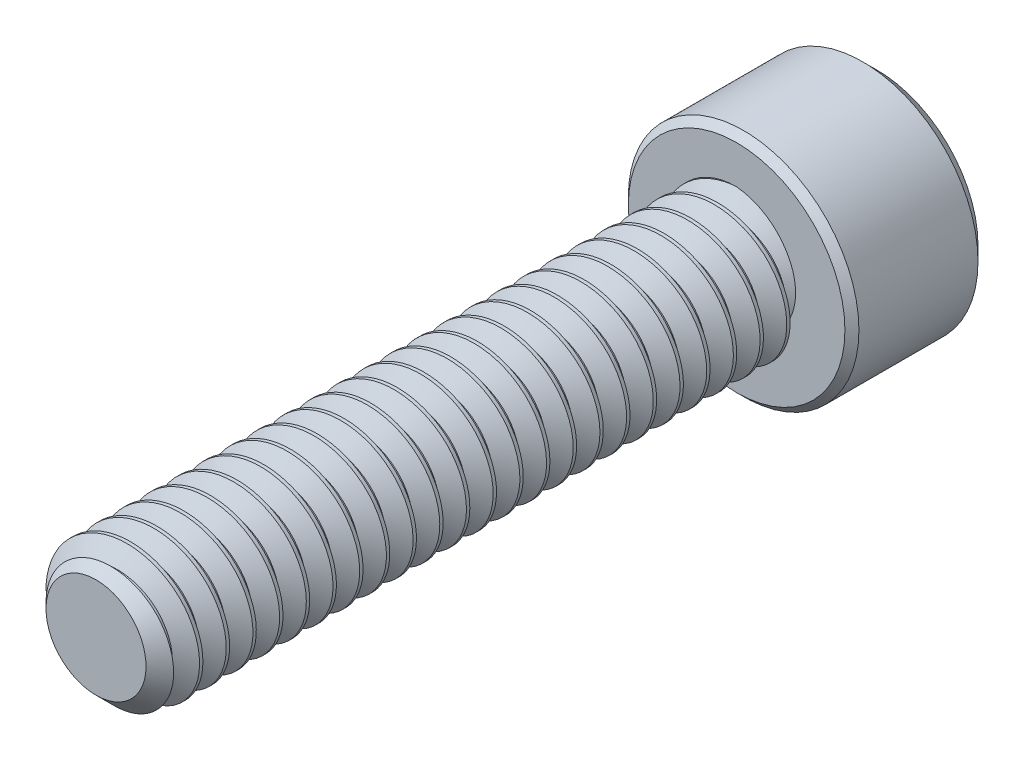
from build123d import *

# Parameters (mm, degrees)
SKETCH1_R          = 2.0828
EXTRUDE1_DEPTH     = 19.05
CHAMFER3_SIZE      = 0.5953125
CUT_SWEEP1_PITCH   = 0.79375
SKETCH6_R          = 3.429
EXTRUDE2_DEPTH     = 4.1656
CUT_EXTRUDE1_DEPTH = 2.67890625
SKETCH8_R          = 2.062222993
CUT_EXTRUDE2_DEPTH = 0.41656
CUT_EXTRUDE2_DRAFT = -45
CHAMFER1_SIZE      = 0.41656
CHAMFER2_SIZE      = 0.20828


with BuildPart() as part:
    # Sketch1 → Extrude1 (new body)
    with BuildSketch(Plane.XY):
        Circle(SKETCH1_R)
    extrude(amount=-EXTRUDE1_DEPTH)

    # Chamfer3
    chamfer3_edges = [part.edges().sort_by_distance(p)[0] for p in [
        (-2.0828, 0, 0),
    ]]
    chamfer(chamfer3_edges, length=CHAMFER3_SIZE)

    # Cut-Sweep1: the profile of Sketch3 profile screwed along a right-hand helix of 25 turns, 6 arcs to a turn; built about Z, then put on its axis
    cut_sweep1_z = Axis((0, 0, 0), (0, 0, 1))
    cut_sweep1_corners = [(2.0831, 0, -0.694704455), (1.567244252, 0, -0.396875), (1.567244252, 0, -0.29765625), (2.0831, 0, 0.000173205)]
    with BuildLine(mode=Mode.PRIVATE) as cut_sweep1_profile:
        Line(cut_sweep1_corners[0], cut_sweep1_corners[1])
        Line(cut_sweep1_corners[1], cut_sweep1_corners[2])
        Line(cut_sweep1_corners[2], cut_sweep1_corners[3])
        Line(cut_sweep1_corners[3], cut_sweep1_corners[0])
    cut_sweep1_cap = Face(cut_sweep1_profile.wire())
    cut_sweep1_turn_angles = [0, 30, 60, 90, 120, 150, 180, 210, 240, 270, 300, 330, 360]
    cut_sweep1_turn_weights = [1, 0.8660254037844387, 1, 0.8660254037844387, 1, 0.8660254037844387, 1, 0.8660254037844387, 1, 0.8660254037844387, 1, 0.8660254037844387, 1]
    cut_sweep1_turn_rails = [Edge.make_bspline([Vector(p[0], p[1], 0).rotate(cut_sweep1_z, cut_sweep1_turn_angles[k]) / cut_sweep1_turn_weights[k] + Vector(0, 0, p[2] + CUT_SWEEP1_PITCH * cut_sweep1_turn_angles[k] / 360) for k in range(13)], [0, 0, 0, 1, 1, 2, 2, 3, 3, 4, 4, 5, 5, 6, 6, 6], 2, cut_sweep1_turn_weights) for p in cut_sweep1_corners]
    cut_sweep1_turn_sides = [Face.make_surface_from_curves(cut_sweep1_turn_rails[p[0]], cut_sweep1_turn_rails[p[1]]) for p in [(0, 1), (1, 2), (2, 3), (3, 0)]]
    cut_sweep1 = Plane(origin=(0, 0, 0), x_dir=(0, 1, 0), z_dir=(0, 0, -1)) * Solid(Shell([*[p.moved(Location((0, 0, CUT_SWEEP1_PITCH * i))) for i in range(25) for p in cut_sweep1_turn_sides], cut_sweep1_cap, cut_sweep1_cap.rotate(cut_sweep1_z, 9000).moved(Location((0, 0, CUT_SWEEP1_PITCH * 9000 / 360)))]))
    add(cut_sweep1, mode=Mode.SUBTRACT)

    # Sketch6 → Extrude2 (add)
    with BuildSketch(Plane(origin=(0, 0, -19.05), x_dir=(-1, 0, 0), z_dir=(0, 0, -1))):
        Circle(SKETCH6_R)
    extrude(amount=EXTRUDE2_DEPTH)

    # Sketch7 → Cut-Extrude1 (cut)
    with BuildSketch(Plane(origin=(0, 0, -23.2156), x_dir=(-1, 0, 0), z_dir=(0, 0, -1))):
        Polygon((0, 2.062222993), (-1.7859375, 1.031111496), (-1.7859375, -1.031111496), (0, -2.062222993), (1.7859375, -1.031111496), (1.7859375, 1.031111496), align=None)
    extrude(amount=-CUT_EXTRUDE1_DEPTH, mode=Mode.SUBTRACT)


with BuildPart() as cut_extrude2_tool:
    # Sketch8 → Cut-Extrude2 (with draft: the straight prism first)
    with BuildSketch(Plane(origin=(0, 0, -23.2156), x_dir=(-1, 0, 0), z_dir=(0, 0, -1))):
        Circle(SKETCH8_R)
    extrude(amount=-CUT_EXTRUDE2_DEPTH)
    # Cut-Extrude2: the draft: its side faces are tilted about the plane it starts from
    cut_extrude2_sides = [cut_extrude2_tool.faces().sort_by_distance(p)[0] for p in [
        (2.062222993, 0, -23.00732),
    ]]
    draft(cut_extrude2_sides, Plane(origin=(0, 0, -23.2156), x_dir=(-1, 0, 0), z_dir=(0, 0, -1)), CUT_EXTRUDE2_DRAFT)


with BuildPart() as part_1:
    add(part.part)

    # Cut-Extrude2: cut by cut_extrude2_tool
    add(cut_extrude2_tool.part, mode=Mode.SUBTRACT)

    # Chamfer1
    chamfer1_edges = [part_1.edges().sort_by_distance(p)[0] for p in [
        (3.429, 0, -23.2156),
    ]]
    chamfer(chamfer1_edges, length=CHAMFER1_SIZE)

    # Chamfer2
    chamfer2_edges = [part_1.edges().sort_by_distance(p)[0] for p in [
        (3.429, 0, -19.05),
    ]]
    chamfer(chamfer2_edges, length=CHAMFER2_SIZE)


solid = part_1.part
